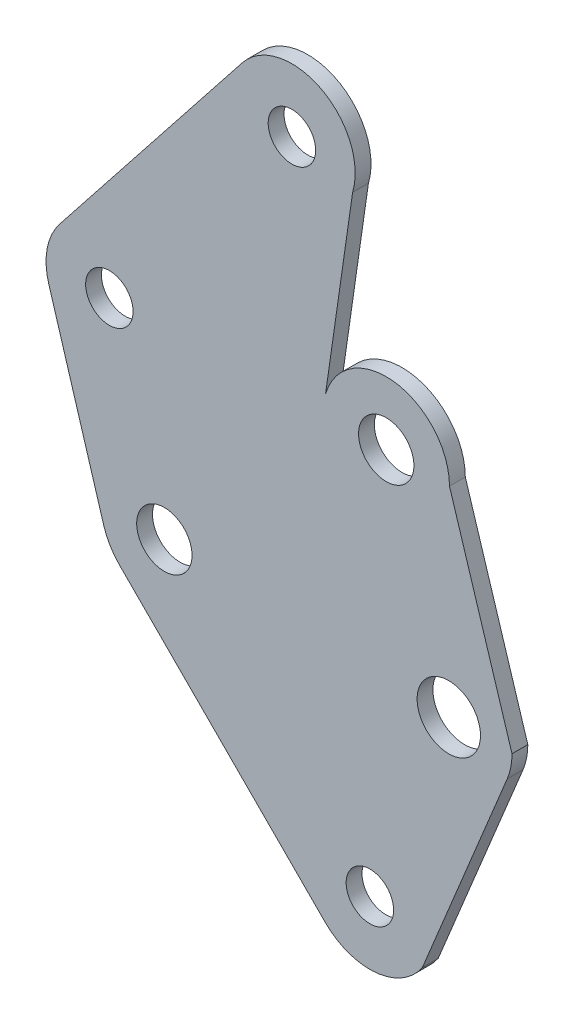
from build123d import *

# Parameters (mm, degrees)
SKETCH_1_R      = 1.5
SKETCH_1_R_2    = 1.75
SKETCH_1_R_3    = 2.003944014
EXTRUDE_1_DEPTH = 1


with BuildPart() as part:
    # 草图1 → 凸台-拉伸1 (new body)
    with BuildSketch(Plane.XY):
        with BuildLine():
            Line((494.605769137, -527.839196558), (481.609593026, -514.791054036))
            ThreePointArc((481.609593026, -514.791054036), (481.010170453, -514.02038782), (480.615305213, -513.127462695))
            Line((480.615305213, -513.127462695), (477.137746123, -501.642402546))
            ThreePointArc((477.137746123, -501.642402546), (477.036205762, -499.737604009), (477.82836441, -498.002365526))
            Line((477.82836441, -498.002365526), (489.371543171, -483.402763587))
            ThreePointArc((489.371543171, -483.402763587), (494.347956643, -482.33084182), (496.347682498, -487.012166828))
            Line((496.347682498, -487.012166828), (494.635210185, -498.909638655))
            ThreePointArc((494.635210185, -498.909638655), (499.042707903, -496.078572348), (502.472829473, -500.037769057))
            Line((502.472829473, -500.037769057), (506.42586238, -512.71203188))
            ThreePointArc((506.42586238, -512.71203188), (506.349706324, -513.4886139), (506.124139786, -514.235607285))
            Line((506.124139786, -514.235607285), (500.760627906, -527.246291449))
            ThreePointArc((500.760627906, -527.246291449), (497.823383917, -528.997987509), (494.605769137, -527.839196558))
        make_face()
        with Locations((480.966099189, -500.483216279)):
            Circle(SKETCH_1_R, mode=Mode.SUBTRACT)
        with Locations((484.443657551, -511.968276648)):
            Circle(SKETCH_1_R_2, mode=Mode.SUBTRACT)
        with Locations((492.509632998, -485.883895059)):
            Circle(SKETCH_1_R, mode=Mode.SUBTRACT)
        with Locations((502.428285494, -512.71203188)):
            Circle(SKETCH_1_R_3, mode=Mode.SUBTRACT)
        with Locations((497.439834468, -525.016418366)):
            Circle(SKETCH_1_R, mode=Mode.SUBTRACT)
        with Locations((498.472829473, -500.037769057)):
            Circle(SKETCH_1_R_2, mode=Mode.SUBTRACT)
    extrude(amount=EXTRUDE_1_DEPTH)


solid = part.part
